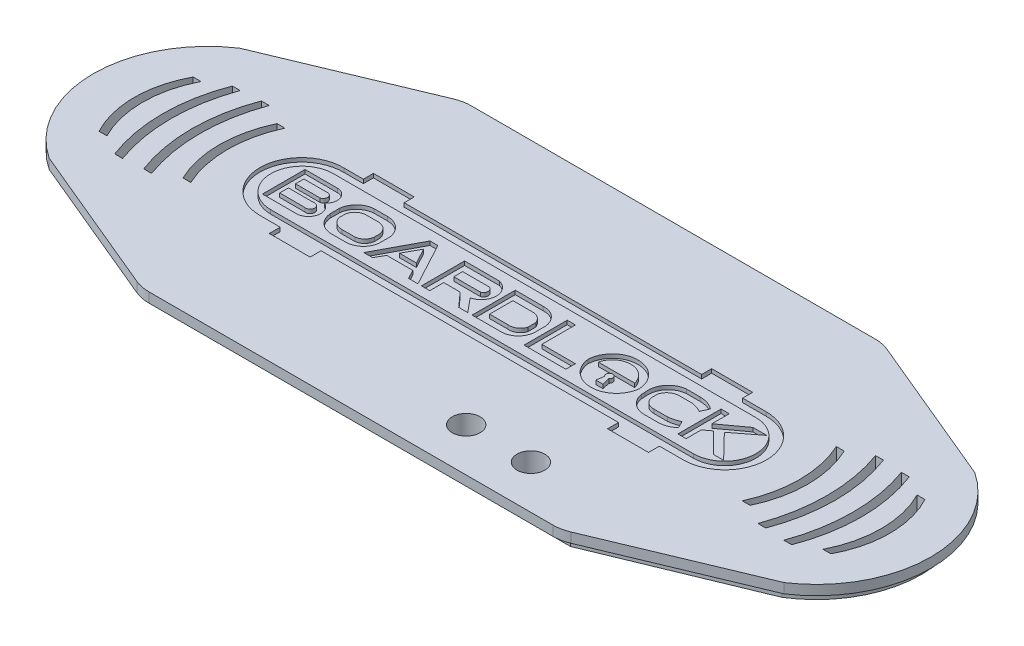
from build123d import *

# Parameters (mm, degrees)
BOSS_EXTRUDE3_DEPTH = 2.5
SKETCH2_8_R         = 3.55
BOSS_EXTRUDE4_DEPTH = 2.5
LOGO_DEPTH          = 1
FILLET1_R           = 10
SOUNDGAPS_REACH     = 178.856
BUTTONS_REACH       = 178.856
SKETCH5_R           = 3.55


with BuildPart() as part:
    # Sketch2 → Boss-Extrude3 (new body)
    with BuildSketch(Plane(origin=(0, 0, 0), x_dir=(1, 0, 0), z_dir=(0, 1, 0))):
        with BuildLine():
            Line((-2.5, 2.5), (104.5, 2.5))
            Line((104.5, 2.5), (144.737244829, -14.291091061))
            ThreePointArc((144.737244829, -14.291091061), (157.8, -38.6), (144.737244829, -62.908908939))
            Line((144.737244829, -62.908908939), (104.5, -79.7))
            Line((104.5, -79.7), (-2.5, -79.7))
            Line((-2.5, -79.7), (-42.737244829, -62.908908939))
            ThreePointArc((-42.737244829, -62.908908939), (-55.8, -38.6), (-42.737244829, -14.291091061))
            Line((-42.737244829, -14.291091061), (-2.5, 2.5))
        make_face()
    extrude(amount=BOSS_EXTRUDE3_DEPTH)

    # Sketch2<8> → Boss-Extrude4 (add)
    with BuildSketch(Plane(origin=(0, 0, 0), x_dir=(1, 0, 0), z_dir=(0, 1, 0))):
        with BuildLine():
            Line((102, 0), (0, 0))
            Line((0, 0), (-2.5, 0))
            Line((-2.5, 0), (-40.702591635, -15.743739118))
            ThreePointArc((-40.702591635, -15.743739118), (-53.480653983, -38.6), (-40.702591635, -61.456260882))
            Line((-40.702591635, -61.456260882), (-2.5, -77.2))
            Line((-2.5, -77.2), (0, -77.2))
            Line((0, -77.2), (102, -77.2))
            Line((102, -77.2), (104.5, -77.2))
            Line((104.5, -77.2), (142.702591635, -61.456260882))
            ThreePointArc((142.702591635, -61.456260882), (155.480653983, -38.6), (142.702591635, -15.743739118))
            Line((142.702591635, -15.743739118), (104.5, 0))
            Line((104.5, 0), (102, 0))
        make_face()
        with Locations((69.32, -68.6)):
            Circle(SKETCH2_8_R, mode=Mode.SUBTRACT)
        with Locations((85.83, -68.6)):
            Circle(SKETCH2_8_R, mode=Mode.SUBTRACT)
    extrude(amount=-BOSS_EXTRUDE4_DEPTH)

    # Sketch3 → Logo (cut)
    # profile 1 of 10: a face of its own
    with BuildSketch(Plane(origin=(0, 2.5, 0), x_dir=(1, 0, 0), z_dir=(0, 1, 0))):
        with BuildLine():
            Line((1.949493887, -27.461955416), (-2.987330566, -27.461955416))
            ThreePointArc((-2.987330566, -27.461955416), (-13.803120325, -38.068295938), (-2.987330566, -48.674636459))
            Line((-2.987330566, -48.674636459), (1.949493887, -48.674636459))
            Line((1.949493887, -48.674636459), (1.949493887, -51.464582861))
            Line((1.949493887, -51.464582861), (12.371678844, -51.464582861))
            Line((12.371678844, -51.464582861), (12.371678844, -48.674636459))
            Line((12.371678844, -48.674636459), (88.239814758, -48.674636459))
            Line((88.239814758, -48.674636459), (88.239814758, -51.464582861))
            Line((88.239814758, -51.464582861), (98.688646078, -51.464582861))
            Line((98.688646078, -51.464582861), (98.688646078, -48.674636459))
            Line((98.688646078, -48.674636459), (104.624475689, -48.674636459))
            ThreePointArc((104.624475689, -48.674636459), (115.383426883, -38.068295938), (104.624475689, -27.461955416))
            Line((104.624475689, -27.461955416), (98.688646078, -27.461955416))
            Line((98.688646078, -27.461955416), (98.688646078, -24.902120515))
            Line((98.688646078, -24.902120515), (88.239814758, -24.902120515))
            Line((88.239814758, -24.902120515), (88.239814758, -27.461955416))
            Line((88.239814758, -27.461955416), (12.371678844, -27.461955416))
            Line((12.371678844, -27.461955416), (12.371678844, -24.902120515))
            Line((12.371678844, -24.902120515), (1.949493887, -24.902120515))
            Line((1.949493887, -24.902120515), (1.949493887, -27.461955416))
        make_face()
        with BuildLine():
            ThreePointArc((-3.194751797, -46.01575407), (-11.064312283, -37.938772353), (-2.987330566, -30.069211866))
            Line((-2.987330566, -30.069211866), (104.700239847, -30.069211866))
            ThreePointArc((104.700239847, -30.069211866), (112.673510949, -38.042482968), (104.700239847, -46.01575407))
            Line((104.700239847, -46.01575407), (-3.194751797, -46.01575407))
        make_face(mode=Mode.SUBTRACT)
    # profile 2 of 10: a face of its own
    with BuildSketch(Plane(origin=(0, 2.5, 0), x_dir=(1, 0, 0), z_dir=(0, 1, 0))):
        with BuildLine():
            Line((0.713326147, -32.762452382), (-7.630609586, -32.762452382))
            Line((-7.630609586, -32.762452382), (-7.630609586, -43.623173078))
            Line((-7.630609586, -43.623173078), (1.144127176, -43.623173078))
            ThreePointArc((1.144127176, -43.623173078), (4.072531045, -41.089719603), (2.23246662, -37.682653616))
            ThreePointArc((2.23246662, -37.682653616), (3.210405226, -34.686087135), (0.713326147, -32.762452382))
        make_face()
        with BuildLine():
            Line((-5.680668083, -41.17440933), (-5.680668083, -38.952382967))
            Line((-5.680668083, -38.952382967), (0.713326147, -38.952382967))
            ThreePointArc((0.713326147, -38.952382967), (2.127219592, -40.063396149), (0.713326147, -41.17440933))
            Line((0.713326147, -41.17440933), (-5.680668083, -41.17440933))
        make_face(mode=Mode.SUBTRACT)
        with BuildLine():
            Line((-5.680668083, -37.138483894), (-5.680668083, -35.007152484))
            Line((-5.680668083, -35.007152484), (0.600049584, -35.007152484))
            ThreePointArc((0.600049584, -35.007152484), (1.408506175, -36.072818189), (0.600049584, -37.138483894))
            Line((0.600049584, -37.138483894), (-5.680668083, -37.138483894))
        make_face(mode=Mode.SUBTRACT)
    # profile 3 of 10: a face of its own
    with BuildSketch(Plane(origin=(0, 2.5, 0), x_dir=(1, 0, 0), z_dir=(0, 1, 0))):
        with BuildLine():
            Line((5.346460441, -36.917426319), (5.346460441, -39.213930644))
            ThreePointArc((5.346460441, -39.213930644), (6.885943052, -42.434479638), (10.251793679, -43.623173078))
            Line((10.251793679, -43.623173078), (13.828264636, -43.623173078))
            ThreePointArc((13.828264636, -43.623173078), (16.716995574, -42.386317426), (18.096652452, -39.562999301))
            Line((18.096652452, -39.562999301), (18.096652452, -36.788822077))
            ThreePointArc((18.096652452, -36.788822077), (16.446939465, -33.787674903), (13.228063284, -32.618370223))
            Line((13.228063284, -32.618370223), (9.865980952, -32.618370223))
            ThreePointArc((9.865980952, -32.618370223), (6.816585637, -33.937769105), (5.346460441, -36.917426319))
        make_face()
        with BuildLine():
            ThreePointArc((7.340408181, -37.428569745), (8.31320862, -35.726361526), (10.137103318, -35.007152484))
            Line((10.137103318, -35.007152484), (13.346680486, -35.007152484))
            ThreePointArc((13.346680486, -35.007152484), (15.178018472, -35.715584435), (16.137891368, -37.428569745))
            Line((16.137891368, -37.428569745), (16.137891368, -38.787399969))
            ThreePointArc((16.137891368, -38.787399969), (15.339335986, -40.518029243), (13.608745934, -41.316669621))
            Line((13.608745934, -41.316669621), (10.291673968, -41.316669621))
            ThreePointArc((10.291673968, -41.316669621), (8.405132361, -40.657148151), (7.340408181, -38.965885242))
            Line((7.340408181, -38.965885242), (7.340408181, -37.428569745))
        make_face(mode=Mode.SUBTRACT)
    # profile 4 of 10: a face of its own
    with BuildSketch(Plane(origin=(0, 2.5, 0), x_dir=(1, 0, 0), z_dir=(0, 1, 0))):
        Polygon((24.087565187, -32.618370223), (18.222944768, -43.623173078), (20.462903956, -43.623173078), (21.766152938, -41.316669621), (28.404577439, -41.316669621), (29.646736625, -43.623173078), (32.02923867, -43.623173078), (26.102641459, -32.618370223), align=None)
        Polygon((27.243871315, -39.213930644), (22.906495797, -39.213930644), (25.095103323, -35.2239905), align=None, mode=Mode.SUBTRACT)
    # profile 5 of 10: a face of its own
    with BuildSketch(Plane(origin=(0, 2.5, 0), x_dir=(1, 0, 0), z_dir=(0, 1, 0))):
        with BuildLine():
            Line((41.793638287, -32.618370223), (32.928013354, -32.618370223))
            Line((32.928013354, -32.618370223), (32.928013354, -43.623173078))
            Line((32.928013354, -43.623173078), (35.04301538, -43.623173078))
            Line((35.04301538, -43.623173078), (35.04301538, -40.063396149))
            Line((35.04301538, -40.063396149), (39.244046803, -40.063396149))
            Line((39.244046803, -40.063396149), (42.431036158, -43.623173078))
            Line((42.431036158, -43.623173078), (44.737782461, -43.623173078))
            Line((44.737782461, -43.623173078), (41.793638287, -40.063396149))
            ThreePointArc((41.793638287, -40.063396149), (44.733866299, -36.340883186), (41.793638287, -32.618370223))
        make_face()
        with BuildLine():
            Line((35.04301538, -37.48051524), (35.04301538, -35.2239905))
            Line((35.04301538, -35.2239905), (41.793638287, -35.2239905))
            ThreePointArc((41.793638287, -35.2239905), (42.65693054, -36.35225287), (41.793638287, -37.48051524))
            Line((41.793638287, -37.48051524), (35.04301538, -37.48051524))
        make_face(mode=Mode.SUBTRACT)
    # profile 6 of 10: a face of its own
    with BuildSketch(Plane(origin=(0, 2.5, 0), x_dir=(1, 0, 0), z_dir=(0, 1, 0))):
        with BuildLine():
            Line((52.968722487, -32.618370223), (45.846335848, -32.618370223))
            Line((45.846335848, -32.618370223), (45.846335848, -43.623173078))
            Line((45.846335848, -43.623173078), (52.83287315, -43.623173078))
            ThreePointArc((52.83287315, -43.623173078), (56.080236632, -42.589880341), (57.64582107, -39.562999301))
            Line((57.64582107, -39.562999301), (57.64582107, -36.788822077))
            ThreePointArc((57.64582107, -36.788822077), (56.171000638, -33.734937317), (52.968722487, -32.618370223))
        make_face()
        with BuildLine():
            Line((47.864668846, -41.17440933), (47.864668846, -35.2239905))
            Line((47.864668846, -35.2239905), (52.599988574, -35.2239905))
            ThreePointArc((52.599988574, -35.2239905), (54.440160348, -35.663250015), (55.624586826, -37.138483894))
            Line((55.624586826, -37.138483894), (55.624586826, -39.18661223))
            ThreePointArc((55.624586826, -39.18661223), (54.462155657, -40.712863912), (52.599988574, -41.17440933))
            Line((52.599988574, -41.17440933), (47.864668846, -41.17440933))
        make_face(mode=Mode.SUBTRACT)
    # profile 7 of 10: a face of its own
    with BuildSketch(Plane(origin=(0, 2.5, 0), x_dir=(1, 0, 0), z_dir=(0, 1, 0))):
        Polygon((61.195413218, -32.618370223), (59.109629375, -32.618370223), (59.109629375, -43.623173078), (69.752475136, -43.623173078), (69.752475136, -41.187576484), (61.195413218, -41.187576484), align=None)
    # profile 8 of 10: a face of its own
    with BuildSketch(Plane(origin=(0, 2.5, 0), x_dir=(1, 0, 0), z_dir=(0, 1, 0))):
        with BuildLine():
            ThreePointArc((86.967057925, -37.33302991), (88.24698918, -35.587564651), (90.332173753, -35.007152484))
            Line((90.332173753, -35.007152484), (93.354874286, -35.007152484))
            ThreePointArc((93.354874286, -35.007152484), (94.768458464, -35.327728442), (96.082389221, -35.939753883))
            Line((96.082389221, -35.939753883), (96.979753441, -33.956106658))
            ThreePointArc((96.979753441, -33.956106658), (95.096667996, -32.952004021), (92.988844144, -32.618370223))
            Line((92.988844144, -32.618370223), (89.529268924, -32.618370223))
            ThreePointArc((89.529268924, -32.618370223), (85.927201794, -34.605805074), (84.941711164, -38.6))
            Line((84.941711164, -38.6), (84.941711164, -39.513929713))
            ThreePointArc((84.941711164, -39.513929713), (86.739352365, -42.572399213), (90.127806859, -43.623173078))
            Line((90.127806859, -43.623173078), (93.049792527, -43.623173078))
            ThreePointArc((93.049792527, -43.623173078), (95.178031827, -43.279186153), (97.039888867, -42.192347671))
            Line((97.039888867, -42.192347671), (96.15967403, -40.380436784))
            ThreePointArc((96.15967403, -40.380436784), (94.749505142, -40.914672607), (93.266431414, -41.187576484))
            Line((93.266431414, -41.187576484), (89.766541153, -41.187576484))
            ThreePointArc((89.766541153, -41.187576484), (87.98359415, -40.626914615), (86.967057925, -39.058509102))
            Line((86.967057925, -39.058509102), (86.967057925, -37.33302991))
        make_face()
    # profile 9 of 10: a face of its own
    with BuildSketch(Plane(origin=(0, 2.5, 0), x_dir=(1, 0, 0), z_dir=(0, 1, 0))):
        Polygon((100.433477861, -32.619456407), (98.346127272, -32.619456407), (98.346127272, -43.625930338), (100.433477861, -43.625930338), (100.433477861, -39.738654566), (102.223113581, -38.43184366), (107.375394287, -43.625930338), (110.007271118, -43.625930338), (103.904039503, -37.33302991), (110.007271118, -32.619456407), (106.490539146, -32.619456407), (100.433477861, -37.042386537), align=None)
    # profile 10 of 10: a face of its own
    with BuildSketch(Plane(origin=(0, 2.5, 0), x_dir=(1, 0, 0), z_dir=(0, 1, 0))):
        with BuildLine():
            ThreePointArc((83.440446503, -38.6), (76.914090873, -32.366505687), (70.387735243, -38.6))
            ThreePointArc((70.387735243, -38.6), (76.914090873, -44.419626268), (83.440446503, -38.6))
        make_face()
        with BuildLine():
            Line((75.957169691, -42.192347671), (76.285044547, -40.252788166))
            ThreePointArc((76.285044547, -40.252788166), (76.809249819, -38.728957059), (77.33345509, -40.252788166))
            Line((77.33345509, -40.252788166), (77.846095102, -42.192347671))
            Line((77.846095102, -42.192347671), (75.957169691, -42.192347671))
        make_face(mode=Mode.SUBTRACT)
        with BuildLine():
            Line((81.605728053, -37.905608877), (72.327294748, -37.905608877))
            ThreePointArc((72.327294748, -37.905608877), (76.9665114, -34.227223026), (81.605728053, -37.905608877))
        make_face(mode=Mode.SUBTRACT)
    extrude(amount=-LOGO_DEPTH, mode=Mode.SUBTRACT)

    # Fillet1
    fillet1_edges = [part.edges().sort_by_distance(p)[0] for p in [
        (-2.5, 1.25, -2.5),
        (104.5, 1.25, -2.5),
        (104.5, 1.25, 79.7),
        (-2.5, 1.25, 79.7),
    ]]
    fillet(fillet1_edges, radius=FILLET1_R)

    # Sketch4 → SoundGaps (cut, up to next)
    with BuildSketch(Plane(origin=(0, 2.5, 0), x_dir=(1, 0, 0), z_dir=(0, 1, 0)), mode=Mode.PRIVATE) as soundgaps_sk1:
        with BuildLine():
            Line((-42.336442958, -26.6), (-40.336442958, -26.6))
            ThreePointArc((-40.336442958, -26.6), (-43.210098634, -38.6), (-40.336442958, -50.6))
            Line((-40.336442958, -50.6), (-42.336442958, -50.6))
            ThreePointArc((-42.336442958, -50.6), (-45.345121926, -38.6), (-42.336442958, -26.6))
        make_face()
    soundgaps_tool1 = extrude(soundgaps_sk1.sketch, amount=-SOUNDGAPS_REACH, mode=Mode.PRIVATE) & part.part
    # Sketch4 → SoundGaps (cut, up to next)
    with BuildSketch(Plane(origin=(0, 2.5, 0), x_dir=(1, 0, 0), z_dir=(0, 1, 0)), mode=Mode.PRIVATE) as soundgaps_sk2:
        with BuildLine():
            Line((-35.336442958, -53.6), (-33.336442958, -53.6))
            ThreePointArc((-33.336442958, -53.6), (-35.959167646, -38.6), (-33.336442958, -23.6))
            Line((-33.336442958, -23.6), (-35.336442958, -23.6))
            ThreePointArc((-35.336442958, -23.6), (-38.112185635, -38.6), (-35.336442958, -53.6))
        make_face()
    soundgaps_tool2 = extrude(soundgaps_sk2.sketch, amount=-SOUNDGAPS_REACH, mode=Mode.PRIVATE) & part.part
    # Sketch4 → SoundGaps (cut, up to next)
    with BuildSketch(Plane(origin=(0, 2.5, 0), x_dir=(1, 0, 0), z_dir=(0, 1, 0)), mode=Mode.PRIVATE) as soundgaps_sk3:
        with BuildLine():
            Line((-28.336442958, -23.2), (-26.336442958, -23.2))
            ThreePointArc((-26.336442958, -23.2), (-28.980435332, -38.2), (-26.336442958, -53.2))
            Line((-26.336442958, -53.2), (-28.336442958, -53.2))
            ThreePointArc((-28.336442958, -53.2), (-31.075866522, -38.2), (-28.336442958, -23.2))
        make_face()
    soundgaps_tool3 = extrude(soundgaps_sk3.sketch, amount=-SOUNDGAPS_REACH, mode=Mode.PRIVATE) & part.part
    # Sketch4 → SoundGaps (cut, up to next)
    with BuildSketch(Plane(origin=(0, 2.5, 0), x_dir=(1, 0, 0), z_dir=(0, 1, 0)), mode=Mode.PRIVATE) as soundgaps_sk4:
        with BuildLine():
            Line((-21.336442958, -50.2), (-19.336442958, -50.2))
            ThreePointArc((-19.336442958, -50.2), (-21.944289857, -38.2), (-19.336442958, -26.2))
            Line((-19.336442958, -26.2), (-21.336442958, -26.2))
            ThreePointArc((-21.336442958, -26.2), (-24.039371453, -38.2), (-21.336442958, -50.2))
        make_face()
    soundgaps_tool4 = extrude(soundgaps_sk4.sketch, amount=-SOUNDGAPS_REACH, mode=Mode.PRIVATE) & part.part
    # Sketch4 → SoundGaps (cut, up to next)
    with BuildSketch(Plane(origin=(0, 2.5, 0), x_dir=(1, 0, 0), z_dir=(0, 1, 0)), mode=Mode.PRIVATE) as soundgaps_sk5:
        with BuildLine():
            Line((123.336442958, -26.2), (121.336442958, -26.2))
            ThreePointArc((121.336442958, -26.2), (123.944289857, -38.2), (121.336442958, -50.2))
            Line((121.336442958, -50.2), (123.336442958, -50.2))
            ThreePointArc((123.336442958, -50.2), (126.039371453, -38.2), (123.336442958, -26.2))
        make_face()
    soundgaps_tool5 = extrude(soundgaps_sk5.sketch, amount=-SOUNDGAPS_REACH, mode=Mode.PRIVATE) & part.part
    # Sketch4 → SoundGaps (cut, up to next)
    with BuildSketch(Plane(origin=(0, 2.5, 0), x_dir=(1, 0, 0), z_dir=(0, 1, 0)), mode=Mode.PRIVATE) as soundgaps_sk6:
        with BuildLine():
            Line((130.336442958, -53.2), (128.336442958, -53.2))
            ThreePointArc((128.336442958, -53.2), (130.980435332, -38.2), (128.336442958, -23.2))
            Line((128.336442958, -23.2), (130.336442958, -23.2))
            ThreePointArc((130.336442958, -23.2), (133.075866522, -38.2), (130.336442958, -53.2))
        make_face()
    soundgaps_tool6 = extrude(soundgaps_sk6.sketch, amount=-SOUNDGAPS_REACH, mode=Mode.PRIVATE) & part.part
    # Sketch4 → SoundGaps (cut, up to next)
    with BuildSketch(Plane(origin=(0, 2.5, 0), x_dir=(1, 0, 0), z_dir=(0, 1, 0)), mode=Mode.PRIVATE) as soundgaps_sk7:
        with BuildLine():
            Line((137.336442958, -23.6), (135.336442958, -23.6))
            ThreePointArc((135.336442958, -23.6), (137.959167646, -38.6), (135.336442958, -53.6))
            Line((135.336442958, -53.6), (137.336442958, -53.6))
            ThreePointArc((137.336442958, -53.6), (140.112185635, -38.6), (137.336442958, -23.6))
        make_face()
    soundgaps_tool7 = extrude(soundgaps_sk7.sketch, amount=-SOUNDGAPS_REACH, mode=Mode.PRIVATE) & part.part
    # Sketch4 → SoundGaps (cut, up to next)
    with BuildSketch(Plane(origin=(0, 2.5, 0), x_dir=(1, 0, 0), z_dir=(0, 1, 0)), mode=Mode.PRIVATE) as soundgaps_sk8:
        with BuildLine():
            Line((144.336442958, -50.6), (142.336442958, -50.6))
            ThreePointArc((142.336442958, -50.6), (145.210098634, -38.6), (142.336442958, -26.6))
            Line((142.336442958, -26.6), (144.336442958, -26.6))
            ThreePointArc((144.336442958, -26.6), (147.345121926, -38.6), (144.336442958, -50.6))
        make_face()
    soundgaps_tool8 = extrude(soundgaps_sk8.sketch, amount=-SOUNDGAPS_REACH, mode=Mode.PRIVATE) & part.part
    add(soundgaps_tool1.solids().sort_by_distance((-43.336866, 2.5, 38.6))[0], mode=Mode.SUBTRACT)
    add(soundgaps_tool2.solids().sort_by_distance((-36.164676, 2.5, 38.6))[0], mode=Mode.SUBTRACT)
    add(soundgaps_tool3.solids().sort_by_distance((-29.153278, 2.5, 38.2))[0], mode=Mode.SUBTRACT)
    add(soundgaps_tool4.solids().sort_by_distance((-22.134482, 2.5, 38.2))[0], mode=Mode.SUBTRACT)
    add(soundgaps_tool5.solids().sort_by_distance((124.134482, 2.5, 38.2))[0], mode=Mode.SUBTRACT)
    add(soundgaps_tool6.solids().sort_by_distance((131.153278, 2.5, 38.2))[0], mode=Mode.SUBTRACT)
    add(soundgaps_tool7.solids().sort_by_distance((138.164676, 2.5, 38.6))[0], mode=Mode.SUBTRACT)
    add(soundgaps_tool8.solids().sort_by_distance((145.336866, 2.5, 38.6))[0], mode=Mode.SUBTRACT)

    # Sketch5 → Buttons (cut, up to next)
    with BuildSketch(Plane(origin=(0, 2.5, 0), x_dir=(1, 0, 0), z_dir=(0, 1, 0)), mode=Mode.PRIVATE) as buttons_sk1:
        with Locations((69.32, -68.6)):
            Circle(SKETCH5_R)
    buttons_tool1 = extrude(buttons_sk1.sketch, amount=-BUTTONS_REACH, mode=Mode.PRIVATE) & part.part
    # Sketch5 → Buttons (cut, up to next)
    with BuildSketch(Plane(origin=(0, 2.5, 0), x_dir=(1, 0, 0), z_dir=(0, 1, 0)), mode=Mode.PRIVATE) as buttons_sk2:
        with Locations((85.83, -68.6)):
            Circle(SKETCH5_R)
    buttons_tool2 = extrude(buttons_sk2.sketch, amount=-BUTTONS_REACH, mode=Mode.PRIVATE) & part.part
    add(buttons_tool1.solids().sort_by_distance((69.32, 2.5, 68.6))[0], mode=Mode.SUBTRACT)
    add(buttons_tool2.solids().sort_by_distance((85.83, 2.5, 68.6))[0], mode=Mode.SUBTRACT)


solid = part.part
